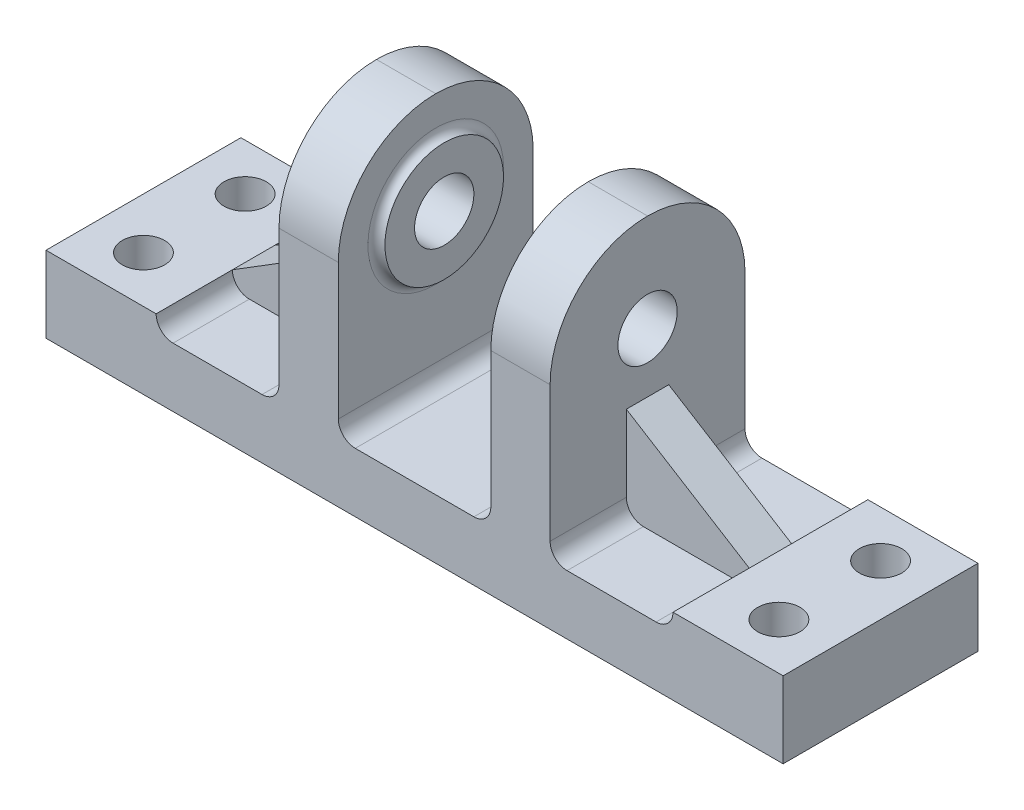
from build123d import *

# Parameters (mm, degrees)
BOSS_EXTRUDE1_DEPTH = 23
FILLET1_R           = 23
SKETCH2_R           = 14
BOSS_EXTRUDE2_DEPTH = 2
HOLE1_D             = 14
FILLET2_R           = 2
FILLET3_R           = 4
RIB1_REACH          = 117.875
SKETCH5_WALL_W      = 267.881961488
SKETCH5_WALL_H      = 10
HOLE2_D             = 10


with BuildPart() as part:
    # Sketch1 → Boss-Extrude1 (new, symmetric)
    with BuildSketch(Plane.XY):
        Polygon((-87, 0), (-87, 18), (-61, 18), (-61, 14), (-32, 14), (-32, 73), (-18, 73), (-18, 14), (18, 14), (18, 73), (32, 73), (32, 14), (61, 14), (61, 18), (87, 18), (87, 0), align=None)
    extrude(amount=BOSS_EXTRUDE1_DEPTH, both=True)

    # Fillet1
    fillet1_edges = [part.edges().sort_by_distance(p)[0] for p in [
        (-25, 73, 23),
        (-25, 73, -23),
        (25, 73, -23),
        (25, 73, 23),
    ]]
    fillet(fillet1_edges, radius=FILLET1_R - 0.0001)  # a hair under: the kernel refuses the full size

    # Sketch2 → Boss-Extrude2 (add)
    with BuildSketch(Plane(origin=(-18, 0, 0), x_dir=(0, 0, -1), z_dir=(1, 0, 0))):
        with Locations(Location((0, 50, 0), (0, 0, 270))):
            Circle(SKETCH2_R)
    boss_extrude2 = extrude(amount=BOSS_EXTRUDE2_DEPTH)

    # Mirror1: Boss-Extrude2 across plane
    add(boss_extrude2.mirror(Plane(origin=(0, 0, 0), x_dir=(0, 0, 1), z_dir=(1, 0, 0))))

    # Hole1 (through all)
    with Locations(Plane(origin=(32, 0, 0), x_dir=(0, 0, -1), z_dir=(1, 0, 0))):
        with Locations((0, 50)):
            Hole(HOLE1_D / 2)

    # Fillet2
    fillet2_edges = [part.edges().sort_by_distance(p)[0] for p in [
        (-18, 64, 0),
        (18, 64, 0),
    ]]
    fillet(fillet2_edges, radius=FILLET2_R - 0.0001)  # a hair under: the kernel refuses the full size

    # Fillet3
    fillet3_edges = [part.edges().sort_by_distance(p)[0] for p in [
        (-32, 14, 0),
        (18, 14, 0),
        (61, 14, 0),
        (32, 14, 0),
        (-18, 14, 0),
        (-61, 14, 0),
    ]]
    fillet(fillet3_edges, radius=FILLET3_R - 0.0001)  # a hair under: the kernel refuses the full size

    # Sketch5 wall → Rib1 (add, up to next)
    with BuildSketch(Plane(origin=(46.5, 27, 0), x_dir=(-0.849640166198, 0.527362861778, 0), z_dir=(-0.527362861778, -0.849640166198, 0)), mode=Mode.PRIVATE) as rib1_sk1:
        Rectangle(SKETCH5_WALL_W, SKETCH5_WALL_H)
    rib1_tool1 = extrude(rib1_sk1.sketch, amount=RIB1_REACH, mode=Mode.PRIVATE) - part.part
    rib1 = rib1_tool1.solids().sort_by_distance((46.5, 27, 0))[0]
    add(rib1)

    # Mirror2: Rib1 across plane
    add(rib1.mirror(Plane(origin=(0, 0, 0), x_dir=(0, 0, 1), z_dir=(1, 0, 0))))

    # Hole2 (through all)
    with Locations(Plane(origin=(0, 18, 0), x_dir=(1, 0, 0), z_dir=(0, 1, 0))):
        with Locations((75, 12), (75, -12)):
            hole2 = Hole(HOLE2_D / 2)

    # Mirror3: Hole2 across plane
    add(hole2.mirror(Plane(origin=(0, 0, 0), x_dir=(0, 0, 1), z_dir=(1, 0, 0))), mode=Mode.SUBTRACT)


solid = part.part
